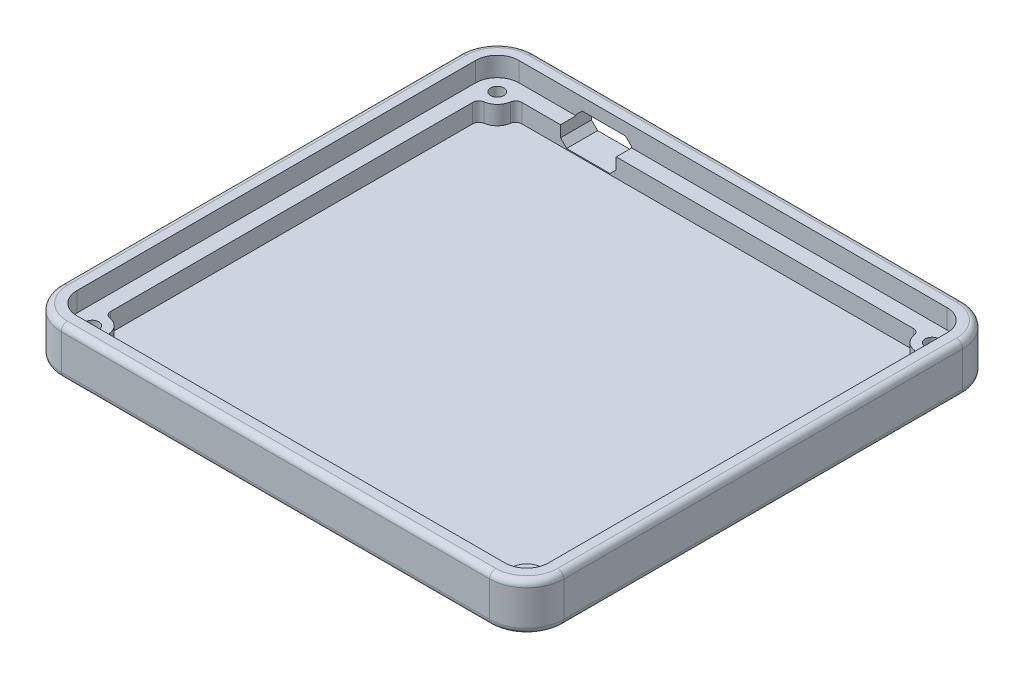
from build123d import *

# Parameters (mm, degrees)
BOSS_EXTRUDE2_DEPTH      = 3
BOSS_EXTRUDE3_DEPTH      = 6
BOSS_EXTRUDE3_DEPTH_BACK = 3
SKETCH3_R                = 2.15
BOSS_EXTRUDE4_DEPTH      = 6.28
CUT_EXTRUDE1_DEPTH       = 10
FILLET1_R                = 2
CUT_EXTRUDE3_DEPTH       = 113.186165145
CUT_EXTRUDE3_DEPTH_BACK  = 113.186165145
SKETCH11_R               = 2.15
CUT_EXTRUDE2_DEPTH       = 4
FILLET4_R                = 2
CUT_EXTRUDE5_DEPTH       = 2
SKETCH14_R               = 10
CUT_EXTRUDE6_DEPTH       = 2


with BuildPart() as part:
    # Sketch2 → Boss-Extrude2 (new body)
    with BuildSketch(Plane(origin=(0, 0, 0), x_dir=(1, 0, 0), z_dir=(0, 1, 0))):
        with BuildLine():
            Line((-69.195, 71.435), (69.195, 71.435))
            ThreePointArc((69.195, 71.435), (74.144747468, 69.384747468), (76.195, 64.435))
            Line((76.195, 64.435), (76.195, -64.435))
            ThreePointArc((76.195, -64.435), (74.144747468, -69.384747468), (69.195, -71.435))
            Line((69.195, -71.435), (-69.195, -71.435))
            ThreePointArc((-69.195, -71.435), (-74.144747468, -69.384747468), (-76.195, -64.435))
            Line((-76.195, -64.435), (-76.195, 64.435))
            ThreePointArc((-76.195, 64.435), (-74.144747468, 69.384747468), (-69.195, 71.435))
        make_face()
    extrude(amount=BOSS_EXTRUDE2_DEPTH)

    # Sketch3 → Boss-Extrude3 (add, two sides: drawn at the far end of the back side and taken through both)
    with BuildSketch(Plane(origin=(0, 3, 0), x_dir=(1, 0, 0), z_dir=(0, 1, 0)).offset(-BOSS_EXTRUDE3_DEPTH_BACK)):
        with BuildLine():
            ThreePointArc((-69.195, 76.435), (-77.680281374, 72.920281374), (-81.195, 64.435))
            Line((-81.195, 64.435), (-81.195, -64.435))
            ThreePointArc((-81.195, -64.435), (-77.680281374, -72.920281374), (-69.195, -76.435))
            Line((-69.195, -76.435), (69.195, -76.435))
            ThreePointArc((69.195, -76.435), (77.680281374, -72.920281374), (81.195, -64.435))
            Line((81.195, -64.435), (81.195, 64.435))
            ThreePointArc((81.195, 64.435), (77.680281374, 72.920281374), (69.195, 76.435))
            Line((69.195, 76.435), (-69.195, 76.435))
        make_face()
        with Locations((-70.2, -65.44)):
            Circle(SKETCH3_R, mode=Mode.SUBTRACT)
        with Locations((70.2, -65.44)):
            Circle(SKETCH3_R, mode=Mode.SUBTRACT)
        with BuildLine():
            Line((-71.195, -60.44), (-71.195, 60.44))
            Line((-71.195, 60.44), (-70.195, 60.44))
            ThreePointArc((-70.195, 60.44), (-66.663001628, 61.903001628), (-65.2, 65.435))
            Line((-65.2, 65.435), (-65.2, 66.435))
            Line((-65.2, 66.435), (65.2, 66.435))
            Line((65.2, 66.435), (65.2, 65.435))
            ThreePointArc((65.2, 65.435), (66.663001628, 61.903001628), (70.195, 60.44))
            Line((70.195, 60.44), (71.195, 60.44))
            Line((71.195, 60.44), (71.195, -60.44))
            Line((71.195, -60.44), (70.195, -60.44))
            ThreePointArc((70.195, -60.44), (66.663001628, -61.903001628), (65.2, -65.435))
            Line((65.2, -65.435), (65.2, -66.435))
            Line((65.2, -66.435), (-65.2, -66.435))
            Line((-65.2, -66.435), (-65.2, -65.435))
            ThreePointArc((-65.2, -65.435), (-66.663001628, -61.903001628), (-70.195, -60.44))
            Line((-70.195, -60.44), (-71.195, -60.44))
        make_face(mode=Mode.SUBTRACT)
        with Locations((-70.2, 65.44)):
            Circle(SKETCH3_R, mode=Mode.SUBTRACT)
        with Locations((70.2, 65.44)):
            Circle(SKETCH3_R, mode=Mode.SUBTRACT)
    extrude(amount=BOSS_EXTRUDE3_DEPTH + BOSS_EXTRUDE3_DEPTH_BACK)

    # Sketch8 → Boss-Extrude4 (add)
    with BuildSketch(Plane(origin=(0, 9, 0), x_dir=(1, 0, 0), z_dir=(0, 1, 0))):
        with BuildLine():
            ThreePointArc((-81.195, -64.435), (-77.680281374, -72.920281374), (-69.195, -76.435))
            Line((-69.195, -76.435), (69.195, -76.435))
            ThreePointArc((69.195, -76.435), (77.680281374, -72.920281374), (81.195, -64.435))
            Line((81.195, -64.435), (81.195, 64.435))
            ThreePointArc((81.195, 64.435), (77.680281374, 72.920281374), (69.195, 76.435))
            Line((69.195, 76.435), (-69.195, 76.435))
            ThreePointArc((-69.195, 76.435), (-77.680281374, 72.920281374), (-81.195, 64.435))
            Line((-81.195, 64.435), (-81.195, -64.435))
        make_face()
        with BuildLine():
            Line((76.195, 64.435), (76.195, -64.435))
            ThreePointArc((76.195, -64.435), (74.144747468, -69.384747468), (69.195, -71.435))
            Line((69.195, -71.435), (-69.195, -71.435))
            ThreePointArc((-69.195, -71.435), (-74.144747468, -69.384747468), (-76.195, -64.435))
            Line((-76.195, -64.435), (-76.195, 64.435))
            ThreePointArc((-76.195, 64.435), (-74.144747468, 69.384747468), (-69.195, 71.435))
            Line((-69.195, 71.435), (69.195, 71.435))
            ThreePointArc((69.195, 71.435), (74.144747468, 69.384747468), (76.195, 64.435))
        make_face(mode=Mode.SUBTRACT)
    extrude(amount=BOSS_EXTRUDE4_DEPTH)

    # Sketch9 → Cut-Extrude1 (cut)
    with BuildSketch(Plane(origin=(0, 0, -76.435), x_dir=(-1, 0, 0), z_dir=(0, 0, -1))):
        Polygon((48.765, 11.345), (34.765, 11.345), (32.765, 9.345), (32.765, 5.345), (34.765, 3.345), (48.765, 3.345), (50.765, 5.345), (50.765, 9.345), align=None)
    extrude(amount=-CUT_EXTRUDE1_DEPTH, mode=Mode.SUBTRACT)

    # Fillet1
    fillet1_edges = [part.edges().sort_by_distance(p)[0] for p in [
        (-65.2, 6, -66.435),
        (-71.195, 6, -60.44),
        (-71.195, 6, 60.44),
        (-65.2, 6, 66.435),
        (71.195, 6, 60.44),
        (65.2, 6, 66.435),
        (65.2, 6, -66.435),
        (71.195, 6, -60.44),
    ]]
    fillet(fillet1_edges, radius=FILLET1_R)

    # Sketch11 → Cut-Extrude3 (cut, two sides: drawn at the far end of the back side and taken through both)
    with BuildSketch(Plane(origin=(0, 3, 0), x_dir=(1, 0, 0), z_dir=(0, 1, 0)).offset(-CUT_EXTRUDE3_DEPTH_BACK)):
        with Locations((-70.2, 65.44)):
            Circle(SKETCH11_R)
        with Locations((70.2, 65.44)):
            Circle(SKETCH11_R)
        with Locations((70.2, -65.496439375)):
            Circle(SKETCH11_R)
        with Locations((-70.2, -65.44)):
            Circle(SKETCH11_R)
    extrude(amount=CUT_EXTRUDE3_DEPTH + CUT_EXTRUDE3_DEPTH_BACK, mode=Mode.SUBTRACT)

    # Sketch10 → Cut-Extrude2 (cut)
    with BuildSketch(Plane.XZ):
        Polygon((66.158548116, 65.44), (68.179274058, 61.94), (72.220725942, 61.94), (74.241451884, 65.44), (72.220725942, 68.94), (68.179274058, 68.94), align=None)
        Polygon((-68.179274058, 61.94), (-66.158548116, 65.44), (-68.179274058, 68.94), (-72.220725942, 68.94), (-74.241451884, 65.44), (-72.220725942, 61.94), align=None)
        Polygon((74.241451884, -65.44), (72.220725942, -61.94), (68.179274058, -61.94), (66.158548116, -65.44), (68.179274058, -68.94), (72.220725942, -68.94), align=None)
        Polygon((-66.158548116, -65.44), (-68.179274058, -61.94), (-72.220725942, -61.94), (-74.241451884, -65.44), (-72.220725942, -68.94), (-68.179274058, -68.94), align=None)
    extrude(amount=-CUT_EXTRUDE2_DEPTH, mode=Mode.SUBTRACT)

    # Fillet4
    fillet4_edges = [part.edges().sort_by_distance(p)[0] for p in [
        (-77.680281374, 0, -72.920281374),
        (0, 0, -76.435),
        (77.680281374, 0, -72.920281374),
        (81.195, 0, 0),
        (77.680281374, 0, 72.920281374),
        (0, 0, 76.435),
        (-77.680281374, 0, 72.920281374),
        (-77.680281374, 15.28, -72.920281374),
        (0, 15.28, -76.435),
        (77.680281374, 15.28, -72.920281374),
        (81.195, 15.28, 0),
        (77.680281374, 15.28, 72.920281374),
        (0, 15.28, 76.435),
        (-77.680281374, 15.28, 72.920281374),
        (-81.195, 0, 0),
        (-81.195, 15.28, 0),
    ]]
    fillet(fillet4_edges, radius=FILLET4_R)

    # Sketch13 → Cut-Extrude5 (cut)
    with BuildSketch(Plane.XZ):
        with BuildLine():
            Line((-15, -25.435), (15, -25.435))
            ThreePointArc((15, -25.435), (21, -31.435), (15, -37.435))
            Line((15, -37.435), (-15, -37.435))
            ThreePointArc((-15, -37.435), (-21, -31.435), (-15, -25.435))
        make_face()
    extrude(amount=-CUT_EXTRUDE5_DEPTH, mode=Mode.SUBTRACT)

    # Sketch14 → Cut-Extrude6 (cut)
    with BuildSketch(Plane.XZ):
        with Locations((-55, -56.435)):
            Circle(SKETCH14_R)
        with Locations((55, -56.435)):
            Circle(SKETCH14_R)
    extrude(amount=-CUT_EXTRUDE6_DEPTH, mode=Mode.SUBTRACT)


solid = part.part
